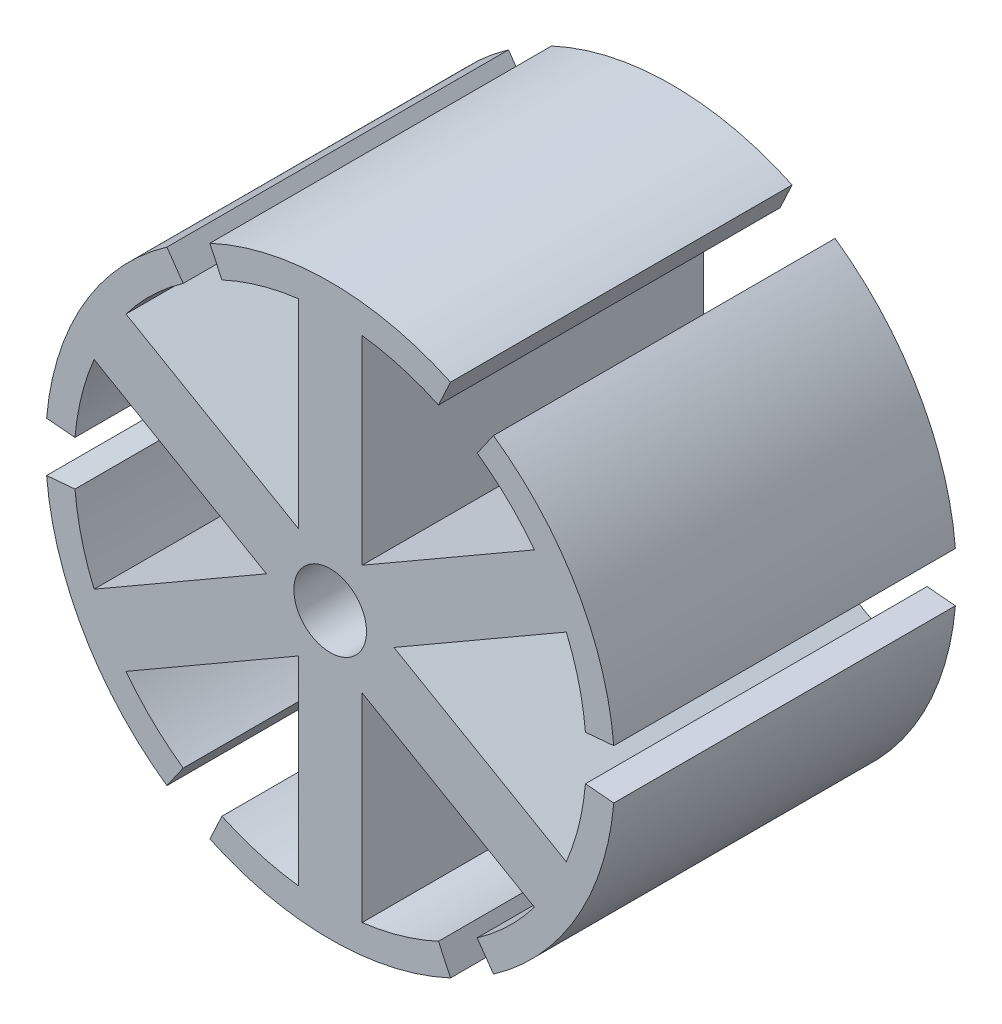
from build123d import *

# Parameters (mm, degrees)
BOSS_EXTRUDE1_DEPTH = 30
SKETCH4_R           = 3.19
CUT_EXTRUDE1_DEPTH  = 30


with BuildPart() as part:
    # Sketch2 → Boss-Extrude1 (new body)
    with BuildSketch(Plane.XY):
        with BuildLine():
            Line((2.8, 4.849742261), (17.934101996, 13.587420123))
            ThreePointArc((17.934101996, 13.587420123), (15.608801126, 16.205410436), (12.905469818, 18.430920997))
            Line((12.905469818, 18.430920997), (14.339410909, 20.478801107))
            ThreePointArc((14.339410909, 20.478801107), (21.650635095, 12.5), (24.904867452, 2.178893569))
            Line((24.904867452, 2.178893569), (22.414380707, 1.961004212))
            ThreePointArc((22.414380707, 1.961004212), (21.83869768, 5.41491308), (20.734101996, 8.737677861))
            Line((20.734101996, 8.737677861), (5.6, 0))
            Line((5.6, 0), (20.734101996, -8.737677861))
            ThreePointArc((20.734101996, -8.737677861), (21.83869768, -5.41491308), (22.414380707, -1.961004212))
            Line((22.414380707, -1.961004212), (24.904867452, -2.178893569))
            ThreePointArc((24.904867452, -2.178893569), (21.650635095, -12.5), (14.339410909, -20.478801107))
            Line((14.339410909, -20.478801107), (12.905469818, -18.430920997))
            ThreePointArc((12.905469818, -18.430920997), (15.608801126, -16.205410436), (17.934101996, -13.587420123))
            Line((17.934101996, -13.587420123), (2.8, -4.849742261))
            Line((2.8, -4.849742261), (2.8, -22.325097984))
            ThreePointArc((2.8, -22.325097984), (6.229896553, -21.620323516), (9.508910889, -20.391925208))
            Line((9.508910889, -20.391925208), (10.565456544, -22.657694676))
            ThreePointArc((10.565456544, -22.657694676), (0, -25), (-10.565456544, -22.657694676))
            Line((-10.565456544, -22.657694676), (-9.508910889, -20.391925208))
            ThreePointArc((-9.508910889, -20.391925208), (-6.229896553, -21.620323516), (-2.8, -22.325097984))
            Line((-2.8, -22.325097984), (-2.8, -4.849742261))
            Line((-2.8, -4.849742261), (-17.934101996, -13.587420123))
            ThreePointArc((-17.934101996, -13.587420123), (-15.608801126, -16.205410436), (-12.905469818, -18.430920997))
            Line((-12.905469818, -18.430920997), (-14.339410909, -20.478801107))
            ThreePointArc((-14.339410909, -20.478801107), (-21.650635095, -12.5), (-24.904867452, -2.178893569))
            Line((-24.904867452, -2.178893569), (-22.414380707, -1.961004212))
            ThreePointArc((-22.414380707, -1.961004212), (-21.83869768, -5.41491308), (-20.734101996, -8.737677861))
            Line((-20.734101996, -8.737677861), (-5.6, 0))
            Line((-5.6, 0), (-20.734101996, 8.737677861))
            ThreePointArc((-20.734101996, 8.737677861), (-21.83869768, 5.41491308), (-22.414380707, 1.961004212))
            Line((-22.414380707, 1.961004212), (-24.904867452, 2.178893569))
            ThreePointArc((-24.904867452, 2.178893569), (-21.650635095, 12.5), (-14.339410909, 20.478801107))
            Line((-14.339410909, 20.478801107), (-12.905469818, 18.430920997))
            ThreePointArc((-12.905469818, 18.430920997), (-15.608801126, 16.205410436), (-17.934101996, 13.587420123))
            Line((-17.934101996, 13.587420123), (-2.8, 4.849742261))
            Line((-2.8, 4.849742261), (-2.8, 22.325097984))
            ThreePointArc((-2.8, 22.325097984), (-6.229896553, 21.620323516), (-9.508910889, 20.391925208))
            Line((-9.508910889, 20.391925208), (-10.565456544, 22.657694676))
            ThreePointArc((-10.565456544, 22.657694676), (0, 25), (10.565456544, 22.657694676))
            Line((10.565456544, 22.657694676), (9.508910889, 20.391925208))
            ThreePointArc((9.508910889, 20.391925208), (6.229896553, 21.620323516), (2.8, 22.325097984))
            Line((2.8, 22.325097984), (2.8, 4.849742261))
        make_face()
    extrude(amount=BOSS_EXTRUDE1_DEPTH)

    # Sketch4 → Cut-Extrude1 (cut)
    with BuildSketch(Plane(origin=(0, 0, 0), x_dir=(-1, 0, 0), z_dir=(0, 0, -1))):
        Circle(SKETCH4_R)
    extrude(amount=-CUT_EXTRUDE1_DEPTH, mode=Mode.SUBTRACT)


solid = part.part
